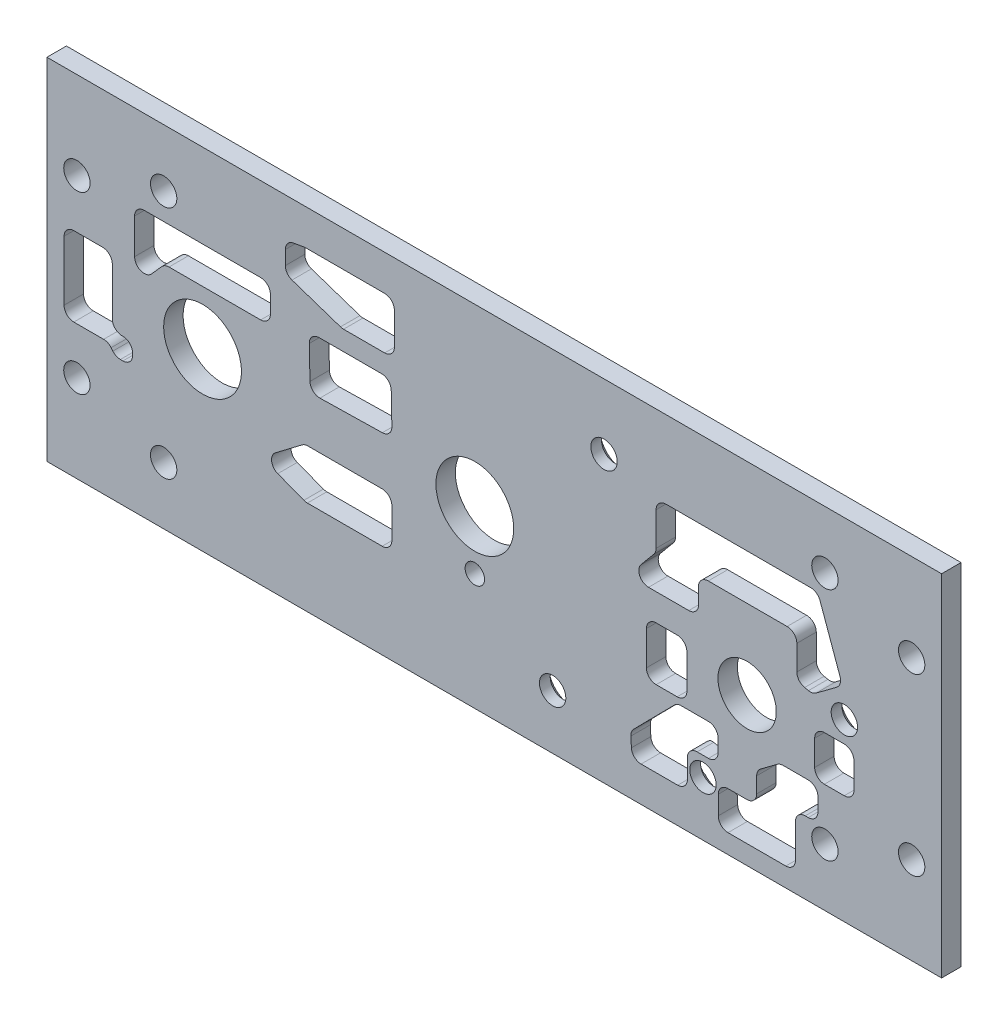
from build123d import *

# Parameters (mm, degrees)
SKETCH1_W                                 = 146.05
SKETCH1_H                                 = 57.15
BOSS_EXTRUDE1_DEPTH                       = 3.175
F_6_CLEARANCE_HOLE1_D                     = 4.3053
F_1_2_0_5_DIAMETER_HOLE1_D                = 12.7
F_3_8_0_375_DIAMETER_HOLE1_D              = 9.525
F_1_8_0_125_DIAMETER_HOLE1_D              = 3.175
CSK_FOR_6_FLAT_HEAD_MACHINE_SCREW_2_COUNT = 2
CSK_FOR_6_FLAT_HEAD_MACHINE_SCREW_2_PITCH = 38.528341037
CSK_FOR_6_FLAT_HEAD_MACHINE_SCREW_3_COUNT = 2
CSK_FOR_6_FLAT_HEAD_MACHINE_SCREW_3_PITCH = 51.534810808
CSK_FOR_6_FLAT_HEAD_MACHINE_SCREW_4_COUNT = 2
CSK_FOR_6_FLAT_HEAD_MACHINE_SCREW_4_PITCH = 24.55
CUT_EXTRUDE1_DEPTH                        = 157.865565453


with BuildPart() as part:
    # Sketch1 → Boss-Extrude1 (new body)
    with BuildSketch(Plane.XY):
        with Locations((-73.025, 28.575)):
            Rectangle(SKETCH1_W, SKETCH1_H)
    extrude(amount=-BOSS_EXTRUDE1_DEPTH)

    # #6 Clearance Hole1 (through all)
    with Locations(Plane(origin=(0, 0, -3.175), x_dir=(-1, 0, 0), z_dir=(0, 0, -1))):
        with Locations((4.8895, 42.8625), (141.1605, 42.8625), (141.1605, 14.2875), (4.8895, 14.2875), (19.05, 47.752), (19.05, 9.398), (127, 9.398), (127, 47.752)):
            Hole(F_6_CLEARANCE_HOLE1_D / 2)

    # 1/2 (0.5) Diameter Hole1 (through all)
    with Locations(Plane(origin=(0, 0, -3.175), x_dir=(-1, 0, 0), z_dir=(0, 0, -1))):
        with Locations((76.2, 28.575), (120.65, 28.575)):
            Hole(F_1_2_0_5_DIAMETER_HOLE1_D / 2)

    # 3/8 (0.375) Diameter Hole1 (through all)
    with Locations(Plane(origin=(0, 0, -3.175), x_dir=(-1, 0, 0), z_dir=(0, 0, -1))):
        with Locations((31.75, 24.13)):
            Hole(F_3_8_0_375_DIAMETER_HOLE1_D / 2)

    # 1/8 (0.125) Diameter Hole1 (through all)
    with Locations(Plane(origin=(0, 0, -3.175), x_dir=(-1, 0, 0), z_dir=(0, 0, -1))):
        with Locations((76.2, 19.05)):
            Hole(F_1_8_0_125_DIAMETER_HOLE1_D / 2)

    # Sketch14 → CSK for #6 Flat Head Machine Screw (100)2 (revolve, cut)
    with BuildSketch(Plane(origin=(-63.5, 8.89, -3.175), x_dir=(0, 1, 0), z_dir=(1, 0, 0))):
        Polygon((0, 0), (0, 3.175), (2.15265, 3.175), (2.15265, 1.420893136), (3.8460045, 0), align=None)
    csk_for_6_flat_head_machine_screw_100 = revolve(axis=Axis((-63.5, 8.89, -9.525), (0, 0, 1)), mode=Mode.SUBTRACT)

    # CSK for _6 Flat Head Machine Screw _ 2: CSK for #6 Flat Head Machine Screw (100)2 ×2
    with Locations(*[Vector(0.21781400598375378, 0.9759902964667782, 0) * (i * CSK_FOR_6_FLAT_HEAD_MACHINE_SCREW_2_PITCH) for i in range(1, CSK_FOR_6_FLAT_HEAD_MACHINE_SCREW_2_COUNT)]):
        add(csk_for_6_flat_head_machine_screw_100, mode=Mode.SUBTRACT)

    # CSK for _6 Flat Head Machine Screw _ 3: CSK for #6 Flat Head Machine Screw (100)2 ×2
    with Locations(*[Vector(0.924132625179902, 0.38207184020561197, 0) * (i * CSK_FOR_6_FLAT_HEAD_MACHINE_SCREW_3_PITCH) for i in range(1, CSK_FOR_6_FLAT_HEAD_MACHINE_SCREW_3_COUNT)]):
        add(csk_for_6_flat_head_machine_screw_100, mode=Mode.SUBTRACT)

    # CSK for _6 Flat Head Machine Screw _ 4: CSK for #6 Flat Head Machine Screw (100)2 ×2
    with Locations(*[(i * CSK_FOR_6_FLAT_HEAD_MACHINE_SCREW_4_PITCH, 0, 0) for i in range(1, CSK_FOR_6_FLAT_HEAD_MACHINE_SCREW_4_COUNT)]):
        add(csk_for_6_flat_head_machine_screw_100, mode=Mode.SUBTRACT)

    # Sketch15 → Cut-Extrude1 (cut, through all)
    with BuildSketch(Plane(origin=(0, 0, -3.175), x_dir=(-1, 0, 0), z_dir=(0, 0, -1))):
        with BuildLine():
            Line((21.347193944, 44.496737247), (45.012101975, 44.496737247))
            ThreePointArc((45.012101975, 44.496737247), (46.13463399, 44.031769262), (46.599601975, 42.909237247))
            Line((46.599601975, 42.909237247), (46.599601975, 37.455762014))
            ThreePointArc((46.599601975, 37.455762014), (46.694341195, 36.915556958), (46.967251112, 36.439828885))
            Line((46.967251112, 36.439828885), (49.067386427, 33.918155163))
            ThreePointArc((49.067386427, 33.918155163), (49.285059493, 32.228663422), (47.847535564, 31.314722034))
            Line((47.847535564, 31.314722034), (41.272484934, 31.314722034))
            ThreePointArc((41.272484934, 31.314722034), (40.149952919, 31.779690019), (39.684984934, 32.902222034))
            Line((39.684984934, 32.902222034), (39.684984934, 35.500151839))
            ThreePointArc((39.684984934, 35.500151839), (39.220016949, 36.622683854), (38.097484934, 37.087651839))
            Line((38.097484934, 37.087651839), (25.219946674, 37.087651839))
            ThreePointArc((25.219946674, 37.087651839), (24.097414659, 36.622683854), (23.632446674, 35.500151839))
            Line((23.632446674, 35.500151839), (23.632446674, 31.446490195))
            ThreePointArc((23.632446674, 31.446490195), (23.273220148, 30.440756372), (22.358115307, 29.89018635))
            Line((22.358115307, 29.89018635), (21.735086079, 29.764816737))
            ThreePointArc((21.735086079, 29.764816737), (21.07300381, 29.772438715), (20.4716192, 30.049472244))
            Line((20.4716192, 30.049472244), (17.132713919, 32.544624196))
            ThreePointArc((17.132713919, 32.544624196), (16.562797005, 33.358995683), (16.588867746, 34.352638739))
            Line((16.588867746, 34.352638739), (19.853049526, 43.445603453))
            ThreePointArc((19.853049526, 43.445603453), (20.433773204, 44.207628098), (21.347193944, 44.496737247))
        make_face()
        with BuildLine():
            Line((43.169356355, 26.904141136), (46.599601975, 26.904141136))
            ThreePointArc((46.599601975, 26.904141136), (47.72213399, 26.439173151), (48.187101975, 25.316641136))
            Line((48.187101975, 25.316641136), (48.187101975, 19.759113808))
            ThreePointArc((48.187101975, 19.759113808), (47.72213399, 18.636581793), (46.599601975, 18.171613808))
            Line((46.599601975, 18.171613808), (43.169356355, 18.171613808))
            ThreePointArc((43.169356355, 18.171613808), (42.04682434, 18.636581793), (41.581856355, 19.759113808))
            Line((41.581856355, 19.759113808), (41.581856355, 25.316641136))
            ThreePointArc((41.581856355, 25.316641136), (42.04682434, 26.439173151), (43.169356355, 26.904141136))
        make_face()
        with BuildLine():
            Line((90.921011843, 42.909237247), (97.627094123, 42.909237247))
            ThreePointArc((97.627094123, 42.909237247), (97.883044016, 42.930006287), (98.132296795, 42.991769968))
            Line((98.132296795, 42.991769968), (106.05071482, 45.6499048))
            ThreePointArc((106.05071482, 45.6499048), (106.83434214, 46.228009897), (107.133012148, 47.154872079))
            Line((107.133012148, 47.154872079), (107.133012148, 49.428843388))
            ThreePointArc((107.133012148, 49.428843388), (106.764882465, 50.44535324), (105.831226598, 50.990420636))
            Line((105.831226598, 50.990420636), (104.128792397, 51.30190702))
            ThreePointArc((104.128792397, 51.30190702), (103.986521957, 51.321335801), (103.843077948, 51.327829771))
            Line((103.843077948, 51.327829771), (90.921011843, 51.327829771))
            ThreePointArc((90.921011843, 51.327829771), (89.798479828, 50.862861786), (89.333511843, 49.740329771))
            Line((89.333511843, 49.740329771), (89.333511843, 44.496737247))
            ThreePointArc((89.333511843, 44.496737247), (89.798479828, 43.374205232), (90.921011843, 42.909237247))
        make_face()
        with BuildLine():
            Line((103.220242116, 38.105312947), (103.112575597, 32.790055366))
            ThreePointArc((103.112575597, 32.790055366), (102.624969488, 31.677170091), (101.493251178, 31.235030952))
            Line((101.493251178, 31.235030952), (91.297625996, 31.441554804))
            ThreePointArc((91.297625996, 31.441554804), (90.184740721, 31.929160912), (89.742601583, 33.060879223))
            Line((89.742601583, 33.060879223), (89.846084729, 38.169612952))
            ThreePointArc((89.846084729, 38.169612952), (90.322152012, 39.271304733), (91.433259145, 39.72496295))
            Line((91.433259145, 39.72496295), (101.633067699, 39.72496295))
            ThreePointArc((101.633067699, 39.72496295), (102.766909483, 39.248570083), (103.220242116, 38.105312947))
        make_face()
        with BuildLine():
            Line((111.160618469, 37.455762014), (126.127535918, 37.455762014))
            ThreePointArc((126.127535918, 37.455762014), (126.77887845, 37.315987526), (127.315523571, 36.921277487))
            Line((127.315523571, 36.921277487), (128.96801187, 35.056978482))
            ThreePointArc((128.96801187, 35.056978482), (130.719127329, 34.625728707), (131.743499523, 36.109993954))
            Line((131.743499523, 36.109993954), (131.743499523, 41.858103453))
            ThreePointArc((131.743499523, 41.858103453), (131.278531539, 42.980635468), (130.155999523, 43.445603453))
            Line((130.155999523, 43.445603453), (111.160618469, 43.445603453))
            ThreePointArc((111.160618469, 43.445603453), (110.038086454, 42.980635468), (109.573118469, 41.858103453))
            Line((109.573118469, 41.858103453), (109.573118469, 39.043262014))
            ThreePointArc((109.573118469, 39.043262014), (110.038086454, 37.920729999), (111.160618469, 37.455762014))
        make_face()
        with BuildLine():
            Line((143.255373049, 33.242227878), (143.255373049, 23.488105242))
            ThreePointArc((143.255373049, 23.488105242), (142.790405064, 22.365573227), (141.667873049, 21.900605242))
            Line((141.667873049, 21.900605242), (136.790853638, 21.900605242))
            ThreePointArc((136.790853638, 21.900605242), (136.116951782, 21.750468292), (135.570517729, 21.328455684))
            Line((135.570517729, 21.328455684), (135.284677058, 20.984907662))
            ThreePointArc((135.284677058, 20.984907662), (134.738243005, 20.562895054), (134.064341149, 20.412758104))
            Line((134.064341149, 20.412758104), (133.647888744, 20.412758104))
            ThreePointArc((133.647888744, 20.412758104), (132.525356729, 20.877726089), (132.060388744, 22.000258104))
            Line((132.060388744, 22.000258104), (132.060388744, 22.31048244))
            ThreePointArc((132.060388744, 22.31048244), (132.525356729, 23.433014455), (133.647888744, 23.89798244))
            Line((133.647888744, 23.89798244), (133.79234852, 23.89798244))
            ThreePointArc((133.79234852, 23.89798244), (134.914880535, 24.362950425), (135.37984852, 25.48548244))
            Line((135.37984852, 25.48548244), (135.37984852, 33.242227878))
            ThreePointArc((135.37984852, 33.242227878), (135.844816504, 34.364759893), (136.96734852, 34.829727878))
            Line((136.96734852, 34.829727878), (141.667873049, 34.829727878))
            ThreePointArc((141.667873049, 34.829727878), (142.790405064, 34.364759893), (143.255373049, 33.242227878))
        make_face()
        with BuildLine():
            Line((91.330101583, 23.488105242), (103.443552944, 23.488105242))
            ThreePointArc((103.443552944, 23.488105242), (103.949252754, 23.405405545), (104.402264412, 23.165922819))
            Line((104.402264412, 23.165922819), (108.757959399, 19.865680406))
            ThreePointArc((108.757959399, 19.865680406), (109.370938476, 18.376878871), (108.367251313, 17.117956539))
            Line((108.367251313, 17.117956539), (104.106217761, 15.485285736))
            ThreePointArc((104.106217761, 15.485285736), (103.827036353, 15.406686542), (103.538214379, 15.380192025))
            Line((103.538214379, 15.380192025), (91.330101583, 15.380192025))
            ThreePointArc((91.330101583, 15.380192025), (90.207569568, 15.84516001), (89.742601583, 16.967692025))
            Line((89.742601583, 16.967692025), (89.742601583, 21.900605242))
            ThreePointArc((89.742601583, 21.900605242), (90.207569568, 23.023137257), (91.330101583, 23.488105242))
        make_face()
        with BuildLine():
            Line((15.893552079, 25.131070029), (19.13395461, 25.131070029))
            ThreePointArc((19.13395461, 25.131070029), (20.256486625, 24.666102045), (20.72145461, 23.543570029))
            Line((20.72145461, 23.543570029), (20.72145461, 19.410181066))
            ThreePointArc((20.72145461, 19.410181066), (20.256486625, 18.287649051), (19.13395461, 17.822681066))
            Line((19.13395461, 17.822681066), (15.893552079, 17.822681066))
            ThreePointArc((15.893552079, 17.822681066), (14.771020064, 18.287649051), (14.306052079, 19.410181066))
            Line((14.306052079, 19.410181066), (14.306052079, 23.543570029))
            ThreePointArc((14.306052079, 23.543570029), (14.771020064, 24.666102045), (15.893552079, 25.131070029))
        make_face()
        with BuildLine():
            Line((20.187933278, 15.530456539), (20.187933278, 13.381249162))
            ThreePointArc((20.187933278, 13.381249162), (20.652901263, 12.258717147), (21.775433278, 11.793749162))
            Line((21.775433278, 11.793749162), (22.263834273, 11.793749162))
            ThreePointArc((22.263834273, 11.793749162), (23.386366288, 11.328781177), (23.851334273, 10.206249162))
            Line((23.851334273, 10.206249162), (23.851334273, 4.700283324))
            ThreePointArc((23.851334273, 4.700283324), (24.316302258, 3.577751308), (25.438834273, 3.112783324))
            Line((25.438834273, 3.112783324), (34.874268774, 3.112783324))
            ThreePointArc((34.874268774, 3.112783324), (35.996800789, 3.577751308), (36.461768774, 4.700283324))
            Line((36.461768774, 4.700283324), (36.461768774, 7.752404274))
            ThreePointArc((36.461768774, 7.752404274), (35.996800789, 8.874936289), (34.874268774, 9.339904274))
            Line((34.874268774, 9.339904274), (31.78095374, 9.339904274))
            ThreePointArc((31.78095374, 9.339904274), (30.658421725, 9.804872259), (30.19345374, 10.927404274))
            Line((30.19345374, 10.927404274), (30.19345374, 13.48766735))
            ThreePointArc((30.19345374, 13.48766735), (30.02535773, 14.198616408), (29.556668149, 14.759004584))
            Line((29.556668149, 14.759004584), (26.824960358, 16.801793773))
            ThreePointArc((26.824960358, 16.801793773), (26.375199236, 17.036843625), (25.87424595, 17.117956539))
            Line((25.87424595, 17.117956539), (21.775433278, 17.117956539))
            ThreePointArc((21.775433278, 17.117956539), (20.652901263, 16.652988554), (20.187933278, 15.530456539))
        make_face()
        with BuildLine():
            Line((36.483523041, 15.650989317), (36.483523041, 13.606717392))
            ThreePointArc((36.483523041, 13.606717392), (36.948491026, 12.484185376), (38.071023041, 12.019217392))
            Line((38.071023041, 12.019217392), (39.909174943, 12.019217392))
            ThreePointArc((39.909174943, 12.019217392), (41.031706958, 11.554249407), (41.496674943, 10.431717392))
            Line((41.496674943, 10.431717392), (41.496674943, 7.305820432))
            ThreePointArc((41.496674943, 7.305820432), (41.961642928, 6.183288417), (43.084174943, 5.718320432))
            Line((43.084174943, 5.718320432), (49.055466067, 5.718320432))
            ThreePointArc((49.055466067, 5.718320432), (50.148470915, 6.154518277), (50.640825232, 7.223403391))
            Line((50.640825232, 7.223403391), (50.725030888, 8.84316804))
            ThreePointArc((50.725030888, 8.84316804), (50.623544664, 9.489745826), (50.269837885, 10.040430674))
            Line((50.269837885, 10.040430674), (43.635603444, 16.76583491))
            ThreePointArc((43.635603444, 16.76583491), (43.117948045, 17.115566667), (42.505437282, 17.238489317))
            Line((42.505437282, 17.238489317), (38.071023041, 17.238489317))
            ThreePointArc((38.071023041, 17.238489317), (36.948491026, 16.773521332), (36.483523041, 15.650989317))
        make_face()
    extrude(amount=-CUT_EXTRUDE1_DEPTH, mode=Mode.SUBTRACT)


solid = part.part
